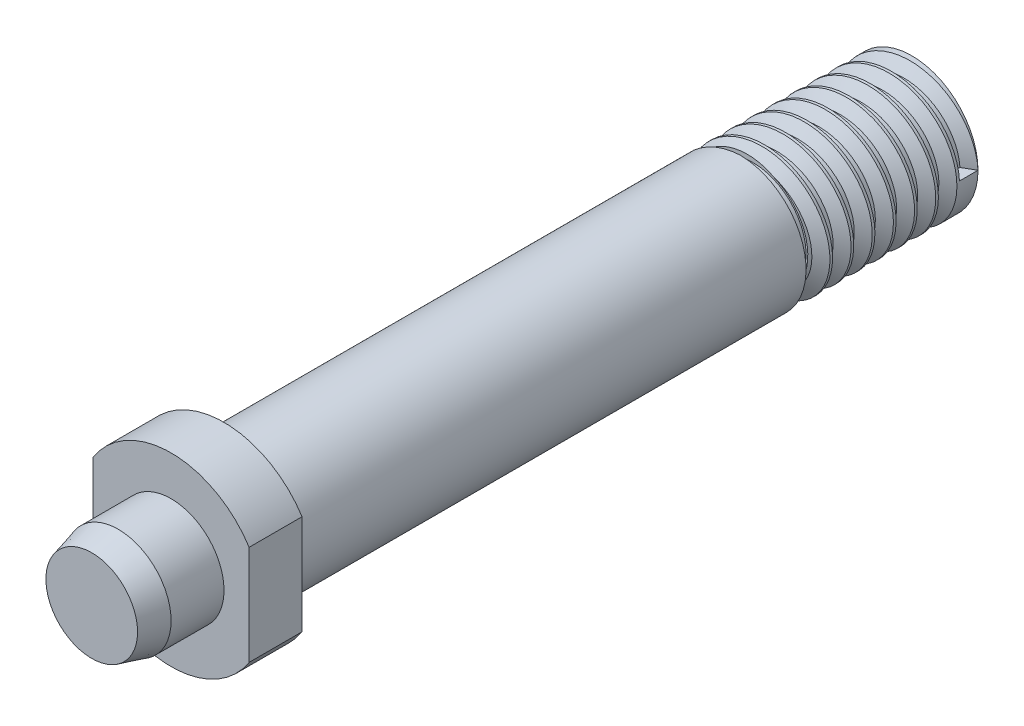
from build123d import *

# Parameters (mm, degrees)
SKETCH1_R           = 2
BOSS_EXTRUDE1_DEPTH = 1
BOSS_EXTRUDE1_TAPER = 15
SKETCH2_R           = 2
BOSS_EXTRUDE2_DEPTH = 2
BOSS_EXTRUDE3_DEPTH = 2
SKETCH4_R           = 2.5
BOSS_EXTRUDE4_DEPTH = 19.5
SKETCH5_R           = 2
BOSS_EXTRUDE5_DEPTH = 0.5
SKETCH6_R           = 2.5
BOSS_EXTRUDE6_DEPTH = 6
THREAD1_PITCH       = 0.8


with BuildPart() as part:
    # Sketch1 → Boss-Extrude1 (new body)
    with BuildSketch(Plane.XY):
        Circle(SKETCH1_R)
    extrude(amount=BOSS_EXTRUDE1_DEPTH, taper=BOSS_EXTRUDE1_TAPER)

    # Sketch2 → Boss-Extrude2 (add)
    with BuildSketch(Plane(origin=(0, 0, 0), x_dir=(-1, 0, 0), z_dir=(0, 0, -1))):
        Circle(SKETCH2_R)
    extrude(amount=BOSS_EXTRUDE2_DEPTH)

    # Sketch3 → Boss-Extrude3 (add)
    with BuildSketch(Plane(origin=(0, 0, -2), x_dir=(-1, 0, 0), z_dir=(0, 0, -1))):
        with BuildLine():
            Line((-2.95, -1.88348082), (-2.95, 1.88348082))
            ThreePointArc((-2.95, 1.88348082), (0, 3.5), (2.95, 1.88348082))
            Line((2.95, 1.88348082), (2.95, -1.88348082))
            ThreePointArc((2.95, -1.88348082), (0, -3.5), (-2.95, -1.88348082))
        make_face()
    extrude(amount=BOSS_EXTRUDE3_DEPTH)

    # Sketch4 → Boss-Extrude4 (add)
    with BuildSketch(Plane(origin=(0, 0, -4), x_dir=(-1, 0, 0), z_dir=(0, 0, -1))):
        Circle(SKETCH4_R)
    extrude(amount=BOSS_EXTRUDE4_DEPTH)

    # Sketch5 → Boss-Extrude5 (add)
    with BuildSketch(Plane(origin=(0, 0, -23.5), x_dir=(-1, 0, 0), z_dir=(0, 0, -1))):
        Circle(SKETCH5_R)
    extrude(amount=BOSS_EXTRUDE5_DEPTH)

    # Sketch6 → Boss-Extrude6 (add)
    with BuildSketch(Plane(origin=(0, 0, -24), x_dir=(-1, 0, 0), z_dir=(0, 0, -1))):
        Circle(SKETCH6_R)
    extrude(amount=BOSS_EXTRUDE6_DEPTH)

    # Thread1: the profile of Thread Profile1 profile screwed along a right-hand helix of 7.5 turns, 8 arcs to a turn; built about Z, then put on its axis
    thread1_z = Axis((0, 0, 0), (0, 0, 1))
    thread1_corners = [(2.5003, 0, -0.000173205), (2.5003, 0, 0.700173203), (2.0669873, 0, 0.449999999), (2.0669873, 0, 0.249999999)]
    with BuildLine(mode=Mode.PRIVATE) as thread1_profile:
        Line(thread1_corners[0], thread1_corners[1])
        Line(thread1_corners[1], thread1_corners[2])
        Line(thread1_corners[2], thread1_corners[3])
        Line(thread1_corners[3], thread1_corners[0])
    thread1_cap = Face(thread1_profile.wire())
    thread1_turn_angles = [0, 22.5, 45, 67.5, 90, 112.5, 135, 157.5, 180, 202.5, 225, 247.5, 270, 292.5, 315, 337.5, 360]
    thread1_turn_weights = [1, 0.9238795325112867, 1, 0.9238795325112867, 1, 0.9238795325112867, 1, 0.9238795325112867, 1, 0.9238795325112867, 1, 0.9238795325112867, 1, 0.9238795325112867, 1, 0.9238795325112867, 1]
    thread1_turn_rails = [Edge.make_bspline([Vector(p[0], p[1], 0).rotate(thread1_z, thread1_turn_angles[k]) / thread1_turn_weights[k] + Vector(0, 0, p[2] + THREAD1_PITCH * thread1_turn_angles[k] / 360) for k in range(17)], [0, 0, 0, 1, 1, 2, 2, 3, 3, 4, 4, 5, 5, 6, 6, 7, 7, 8, 8, 8], 2, thread1_turn_weights) for p in thread1_corners]
    thread1_turn_sides = [Face.make_surface_from_curves(thread1_turn_rails[p[0]], thread1_turn_rails[p[1]]) for p in [(0, 1), (1, 2), (2, 3), (3, 0)]]
    thread1_last_angles = [2520, 2542.5, 2565, 2587.5, 2610, 2632.5, 2655, 2677.5, 2700]
    thread1_last_weights = [1, 0.9238795325112867, 1, 0.9238795325112867, 1, 0.9238795325112867, 1, 0.9238795325112867, 1]
    thread1_last_rails = [Edge.make_bspline([Vector(p[0], p[1], 0).rotate(thread1_z, thread1_last_angles[k]) / thread1_last_weights[k] + Vector(0, 0, p[2] + THREAD1_PITCH * thread1_last_angles[k] / 360) for k in range(9)], [0, 0, 0, 1, 1, 2, 2, 3, 3, 4, 4, 4], 2, thread1_last_weights) for p in thread1_corners]
    thread1_last_sides = [Face.make_surface_from_curves(thread1_last_rails[p[0]], thread1_last_rails[p[1]]) for p in [(0, 1), (1, 2), (2, 3), (3, 0)]]
    thread1 = Plane(origin=(0, 0, -30), x_dir=(1, 0, 0), z_dir=(0, 0, 1)) * Solid(Shell([*[p.moved(Location((0, 0, THREAD1_PITCH * i))) for i in range(7) for p in thread1_turn_sides], *thread1_last_sides, thread1_cap, thread1_cap.rotate(thread1_z, 2700).moved(Location((0, 0, THREAD1_PITCH * 2700 / 360)))]))
    add(thread1, mode=Mode.SUBTRACT)


solid = part.part
